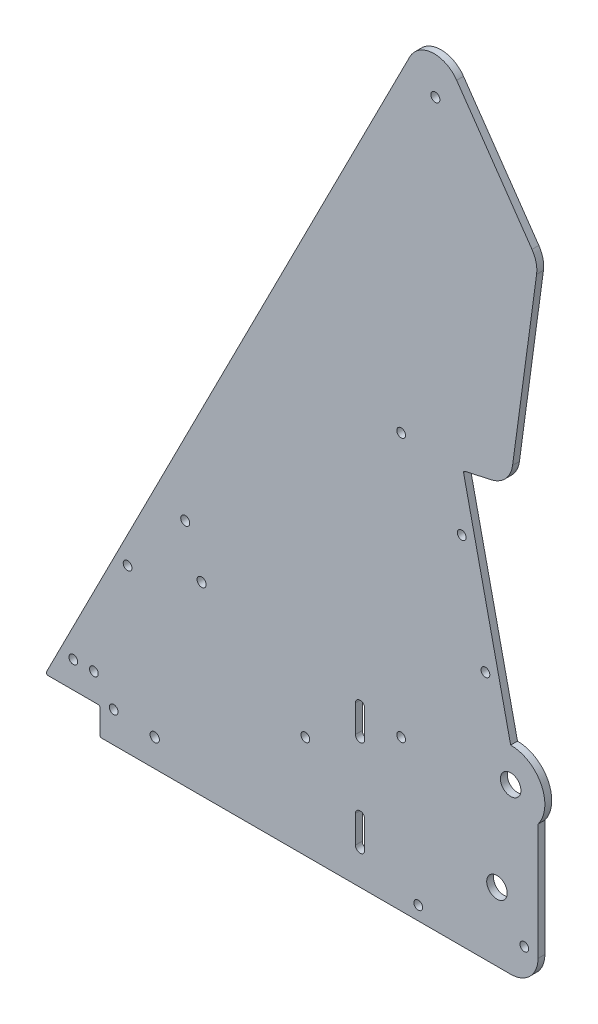
from build123d import *

# Parameters (mm, degrees)
BOSS_EXTRUDE1_DEPTH = 3.175
SKETCH2_R           = 2.0955
SKETCH2_R_2         = 2.032
SKETCH2_R_3         = 4.7625
CUT_EXTRUDE1_DEPTH  = 421.976111717
SKETCH7_R           = 2.159
CUT_EXTRUDE2_DEPTH  = 421.976111717
CUT_EXTRUDE3_REACH  = 422.976
SKETCH10_R          = 2.032
FILLET1_R           = 12.7
FILLET2_R           = 0.79375
SKETCH12_R          = 2.032
CUT_EXTRUDE5_DEPTH  = 411.989226146


with BuildPart() as part:
    # Sketch1 → Boss-Extrude1 (new body)
    with BuildSketch(Plane.XY):
        with BuildLine():
            Line((228.6, -12.7), (228.6, 53.975))
            ThreePointArc((228.6, 53.975), (230.099031657, 70.599515829), (215.9, 79.375))
            Line((215.9, 79.375), (193.909735224, 178.566674323))
            Line((193.909735224, 178.566674323), (215.607913982, 183.377044743))
            Line((215.607913982, 183.377044743), (228.6, 279.4))
            Line((228.6, 279.4), (178.754725958, 351.413083686))
            Line((178.754725958, 351.413083686), (0, 0))
            Line((0, 0), (25.4, 0))
            Line((25.4, 0), (25.4, -12.7))
            Line((25.4, -12.7), (228.6, -12.7))
        make_face()
    extrude(amount=BOSS_EXTRUDE1_DEPTH)

    # Sketch2 → Cut-Extrude1 (cut, through all)
    with BuildSketch(Plane.XY.offset(3.175)):
        with Locations((64.943150167, 94.057839899)):
            Circle(SKETCH2_R)
        with Locations((180.975, 322.164313376)):
            Circle(SKETCH2_R)
        with Locations((72.544547852, 73.173171402)):
            Circle(SKETCH2_R)
        with Locations((193.207821773, 152.394364194)):
            Circle(SKETCH2_R_2)
        with Locations((215.9, 63.5)):
            Circle(SKETCH2_R_3)
        with Locations((173.0375, -6.35)):
            Circle(SKETCH2_R_2)
        with Locations((204.202954161, 102.798527032)):
            Circle(SKETCH2_R_2)
        with Locations((209.55, 19.05)):
            Circle(SKETCH2_R_3)
        with Locations((165.1, 179.3875)):
            Circle(SKETCH2_R_2)
    extrude(amount=-CUT_EXTRUDE1_DEPTH, mode=Mode.SUBTRACT)

    # Sketch7 → Cut-Extrude2 (cut, through all)
    with BuildSketch(Plane.XY.offset(3.175)):
        with Locations((50.8, 0)):
            Circle(SKETCH7_R)
        with BuildLine():
            Line((143.891, 3.175), (143.891, 15.875))
            ThreePointArc((143.891, 15.875), (146.05, 18.034), (148.209, 15.875))
            Line((148.209, 15.875), (148.209, 3.175))
            ThreePointArc((148.209, 3.175), (146.05, 1.016), (143.891, 3.175))
        make_face()
        with BuildLine():
            Line((143.891, 47.625), (143.891, 60.325))
            ThreePointArc((143.891, 60.325), (146.05, 62.484), (148.209, 60.325))
            Line((148.209, 60.325), (148.209, 47.625))
            ThreePointArc((148.209, 47.625), (146.05, 45.466), (143.891, 47.625))
        make_face()
    extrude(amount=-CUT_EXTRUDE2_DEPTH, mode=Mode.SUBTRACT)

    # Sketch10 → Cut-Extrude3 (cut, up to next)
    with BuildSketch(Plane.XY.offset(3.175), mode=Mode.PRIVATE) as cut_extrude3_sk1:
        with Locations((165.1, 57.15)):
            Circle(SKETCH10_R)
    cut_extrude3_tool1 = extrude(cut_extrude3_sk1.sketch, amount=-CUT_EXTRUDE3_REACH, mode=Mode.PRIVATE) & part.part
    # Sketch10 → Cut-Extrude3 (cut, up to next)
    with BuildSketch(Plane.XY.offset(3.175), mode=Mode.PRIVATE) as cut_extrude3_sk2:
        with Locations((120.65, 34.925)):
            Circle(SKETCH10_R)
    cut_extrude3_tool2 = extrude(cut_extrude3_sk2.sketch, amount=-CUT_EXTRUDE3_REACH, mode=Mode.PRIVATE) & part.part
    # Sketch10 → Cut-Extrude3 (cut, up to next)
    with BuildSketch(Plane.XY.offset(3.175), mode=Mode.PRIVATE) as cut_extrude3_sk3:
        with Locations((13.046467246, 12.334704411)):
            Circle(SKETCH10_R)
    cut_extrude3_tool3 = extrude(cut_extrude3_sk3.sketch, amount=-CUT_EXTRUDE3_REACH, mode=Mode.PRIVATE) & part.part
    # Sketch10 → Cut-Extrude3 (cut, up to next)
    with BuildSketch(Plane.XY.offset(3.175), mode=Mode.PRIVATE) as cut_extrude3_sk4:
        with Locations((22.571467246, 12.334704411)):
            Circle(SKETCH10_R)
    cut_extrude3_tool4 = extrude(cut_extrude3_sk4.sketch, amount=-CUT_EXTRUDE3_REACH, mode=Mode.PRIVATE) & part.part
    # Sketch10 → Cut-Extrude3 (cut, up to next)
    with BuildSketch(Plane.XY.offset(3.175), mode=Mode.PRIVATE) as cut_extrude3_sk5:
        with Locations((38.211447917, 62.639810909)):
            Circle(SKETCH10_R)
    cut_extrude3_tool5 = extrude(cut_extrude3_sk5.sketch, amount=-CUT_EXTRUDE3_REACH, mode=Mode.PRIVATE) & part.part
    add(cut_extrude3_tool1.solids().sort_by_distance((165.1, 57.15, 3.175))[0], mode=Mode.SUBTRACT)
    add(cut_extrude3_tool2.solids().sort_by_distance((120.65, 34.925, 3.175))[0], mode=Mode.SUBTRACT)
    add(cut_extrude3_tool3.solids().sort_by_distance((13.046467, 12.334704, 3.175))[0], mode=Mode.SUBTRACT)
    add(cut_extrude3_tool4.solids().sort_by_distance((22.571467, 12.334704, 3.175))[0], mode=Mode.SUBTRACT)
    add(cut_extrude3_tool5.solids().sort_by_distance((38.211448, 62.639811, 3.175))[0], mode=Mode.SUBTRACT)

    # Fillet1
    fillet1_edges = [part.edges().sort_by_distance(p)[0] for p in [
        (228.6, -12.7, 1.5875),
        (178.754725958, 351.413083686, 1.5875),
        (215.607913982, 183.377044743, 1.5875),
        (228.6, 279.4, 1.5875),
    ]]
    fillet(fillet1_edges, radius=FILLET1_R)

    # Fillet2
    fillet2_edges = [part.edges().sort_by_distance(p)[0] for p in [
        (25.4, -12.7, 1.5875),
        (25.4, 0, 1.5875),
        (193.909735224, 178.566674323, 1.5875),
        (0, 0, 1.5875),
    ]]
    fillet(fillet2_edges, radius=FILLET2_R)

    # Sketch12 → Cut-Extrude5 (cut, through all)
    with BuildSketch(Plane.XY.offset(3.175)):
        with Locations((31.75, 1.5875)):
            Circle(SKETCH12_R)
        with Locations((222.25, 1.5875)):
            Circle(SKETCH12_R)
    extrude(amount=-CUT_EXTRUDE5_DEPTH, mode=Mode.SUBTRACT)


solid = part.part
